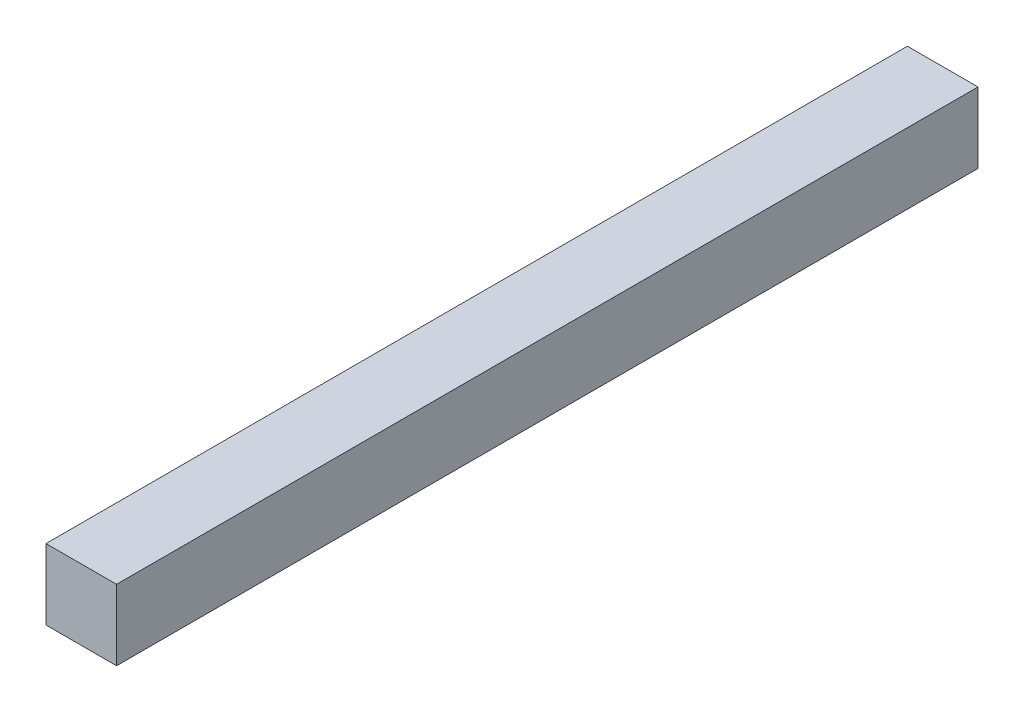
from build123d import *

# Parameters (mm, degrees)
SKETCH1_W           = 12.7
SKETCH1_H           = 12.7
BOSS_EXTRUDE1_DEPTH = 155


with BuildPart() as part:
    # Sketch1 → Boss-Extrude1 (new body)
    with BuildSketch(Plane.XY):
        Rectangle(SKETCH1_W, SKETCH1_H)
    extrude(amount=BOSS_EXTRUDE1_DEPTH)


solid = part.part
